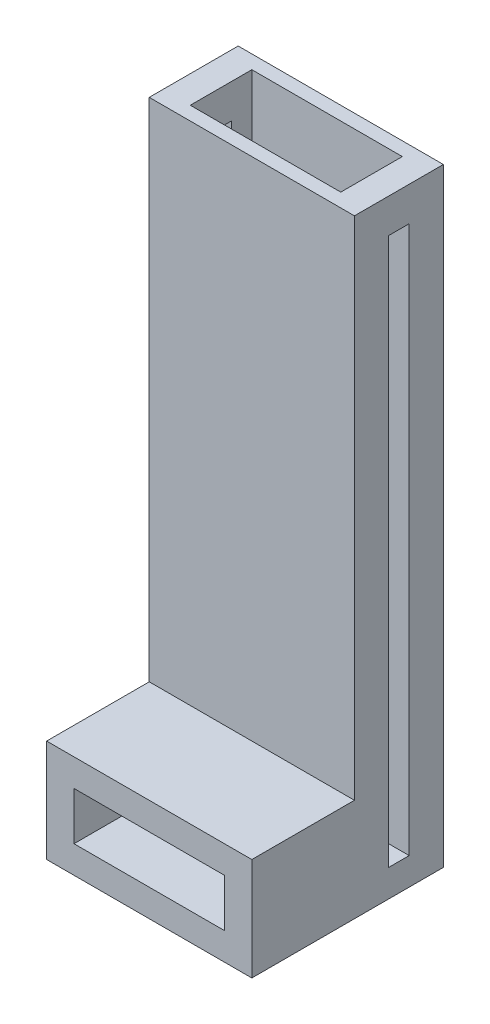
from build123d import *

# Parameters (mm, degrees)
SKETCH1_W           = 30
SKETCH1_H           = 13
BOSS_EXTRUDE1_DEPTH = 85
SKETCH2_W           = 22
SKETCH2_H           = 9
CUT_EXTRUDE2_DEPTH  = 85
SKETCH5_W           = 30
SKETCH5_H           = 13
BOSS_EXTRUDE3_DEPTH = 4
SKETCH12_W          = 22
SKETCH12_H          = 7
CUT_EXTRUDE4_DEPTH  = 13
SKETCH13_W          = 3
SKETCH13_H          = 80
CUT_EXTRUDE5_DEPTH  = 92.07140056
SKETCH14_W          = 30
SKETCH14_H          = 15
BOSS_EXTRUDE4_DEPTH = 15
SKETCH15_W          = 22
SKETCH15_H          = 7
CUT_EXTRUDE6_DEPTH  = 15


with BuildPart() as part:
    # Sketch1 → Boss-Extrude1 (new body)
    with BuildSketch(Plane(origin=(0, 0, 0), x_dir=(1, 0, 0), z_dir=(0, 1, 0))):
        with Locations((15, -6.5)):
            Rectangle(SKETCH1_W, SKETCH1_H)
    extrude(amount=BOSS_EXTRUDE1_DEPTH)

    # Sketch2 → Cut-Extrude2 (cut)
    with BuildSketch(Plane(origin=(0, 85, 0), x_dir=(1, 0, 0), z_dir=(0, 1, 0))):
        with Locations((15, -6.5)):
            Rectangle(SKETCH2_W, SKETCH2_H)
    extrude(amount=-CUT_EXTRUDE2_DEPTH, mode=Mode.SUBTRACT)

    # Sketch5 → Boss-Extrude3 (add)
    with BuildSketch(Plane(origin=(0, 0, 0), x_dir=(1, 0, 0), z_dir=(0, 1, 0))):
        with Locations((15, -6.5)):
            Rectangle(SKETCH5_W, SKETCH5_H)
    extrude(amount=-BOSS_EXTRUDE3_DEPTH)

    # Sketch12 → Cut-Extrude4 (cut)
    with BuildSketch(Plane.XY.offset(13)):
        with Locations((15, 3.5)):
            Rectangle(SKETCH12_W, SKETCH12_H)
    extrude(amount=-CUT_EXTRUDE4_DEPTH, mode=Mode.SUBTRACT)

    # Sketch13 → Cut-Extrude5 (cut, through all)
    with BuildSketch(Plane.ZY):
        with Locations((6.5, 40)):
            Rectangle(SKETCH13_W, SKETCH13_H)
    extrude(amount=-CUT_EXTRUDE5_DEPTH, mode=Mode.SUBTRACT)

    # Sketch14 → Boss-Extrude4 (add)
    with BuildSketch(Plane.XY.offset(13)):
        with Locations((15, 3.5)):
            Rectangle(SKETCH14_W, SKETCH14_H)
    extrude(amount=BOSS_EXTRUDE4_DEPTH)

    # Sketch15 → Cut-Extrude6 (cut)
    with BuildSketch(Plane.XY.offset(28)):
        with Locations((15, 3.5)):
            Rectangle(SKETCH15_W, SKETCH15_H)
    extrude(amount=-CUT_EXTRUDE6_DEPTH, mode=Mode.SUBTRACT)


solid = part.part
